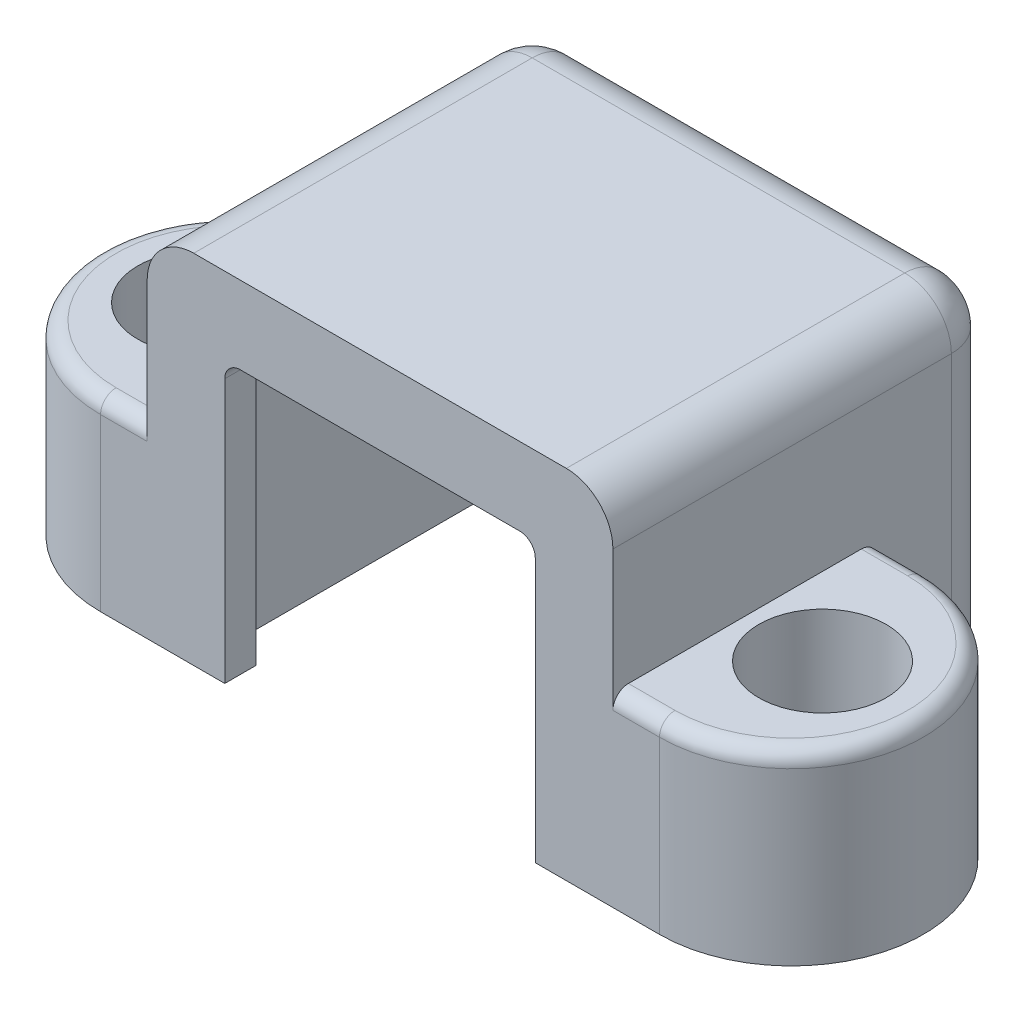
from build123d import *

# Parameters (mm, degrees)
BOSS_EXTRUDE1_DEPTH = 12.4
BOSS_EXTRUDE2_DEPTH = 6
SKETCH4_R           = 2.05
CUT_EXTRUDE1_DEPTH  = 6
FILLET1_R           = 1.5
FILLET2_R           = 0.5
FILLET3_R           = 1
BOSS_EXTRUDE3_DEPTH = 1
FILLET4_R           = 0.5
BOSS_EXTRUDE4_DEPTH = 1
FILLET5_R           = 1.5


with BuildPart() as part:
    # Sketch1 → Boss-Extrude1 (new body)
    with BuildSketch(Plane.XY):
        Polygon((0, 0), (6, 0), (6, -10), (7.5, -10), (7.5, 1.5), (0, 1.5), (-7.5, 1.5), (-7.5, -10), (-6, -10), (-6, 0), align=None)
    extrude(amount=BOSS_EXTRUDE1_DEPTH)

    # Sketch3 → Boss-Extrude2 (add)
    with BuildSketch(Plane.XZ.offset(10)):
        with BuildLine():
            Line((7.5, 3.9), (7.5, 12.4))
            Line((7.5, 12.4), (9, 12.4))
            ThreePointArc((9, 12.4), (13.25, 8.15), (9, 3.9))
            Line((9, 3.9), (7.5, 3.9))
        make_face()
        with BuildLine():
            Line((-7.5, 12.4), (-9, 12.4))
            ThreePointArc((-9, 12.4), (-13.25, 8.15), (-9, 3.9))
            Line((-9, 3.9), (-7.5, 3.9))
            Line((-7.5, 3.9), (-7.5, 12.4))
        make_face()
    extrude(amount=-BOSS_EXTRUDE2_DEPTH)

    # Sketch4 → Cut-Extrude1 (cut)
    with BuildSketch(Plane.XZ.offset(10)):
        with Locations(Location((-10, 8.15, 0), (0, 0, 270))):
            Circle(SKETCH4_R)
        with Locations(Location((10, 8.15, 0), (0, 0, 270))):
            Circle(SKETCH4_R)
    extrude(amount=-CUT_EXTRUDE1_DEPTH, mode=Mode.SUBTRACT)

    # Fillet1
    fillet1_edges = [part.edges().sort_by_distance(p)[0] for p in [
        (-7.5, 1.5, 6.2),
        (7.5, 1.5, 6.2),
    ]]
    fillet(fillet1_edges, radius=FILLET1_R)

    # Fillet2
    fillet2_edges = [part.edges().sort_by_distance(p)[0] for p in [
        (8.25, -4, 3.9),
        (8.25, -4, 12.4),
        (13.25, -4, 8.15),
        (-13.25, -4, 8.15),
        (-8.25, -4, 12.4),
        (-8.25, -4, 3.9),
    ]]
    fillet(fillet2_edges, radius=FILLET2_R)

    # Fillet3
    fillet3_edges = [part.edges().sort_by_distance(p)[0] for p in [
        (6, 0, 6.2),
        (-6, 0, 6.2),
    ]]
    fillet(fillet3_edges, radius=FILLET3_R)

    # Sketch6 → Boss-Extrude3 (add)
    with BuildSketch(Plane(origin=(0, 0, 12.4), x_dir=(-1, 0, 0), z_dir=(0, 0, -1))):
        with BuildLine():
            Line((6, -10), (6, -1))
            ThreePointArc((6, -1), (5.707106781, -0.292893219), (5, 0))
            Line((5, 0), (-5, 0))
            ThreePointArc((-5, 0), (-5.707106781, -0.292893219), (-6, -1))
            Line((-6, -1), (-6, -10))
            Line((-6, -10), (-5, -10))
            Line((-5, -10), (-5, -1))
            Line((-5, -1), (5, -1))
            Line((5, -1), (5, -10))
            Line((5, -10), (6, -10))
        make_face()
    extrude(amount=BOSS_EXTRUDE3_DEPTH)

    # Fillet4
    fillet4_edges = [part.edges().sort_by_distance(p)[0] for p in [
        (5, -1, 11.9),
        (-5, -1, 11.9),
    ]]
    fillet(fillet4_edges, radius=FILLET4_R)

    # Sketch7 → Boss-Extrude4 (add)
    with BuildSketch(Plane(origin=(0, 0, 5.55), x_dir=(-1, 0, 0), z_dir=(0, 0, -1))):
        with BuildLine():
            Line((-4, 0), (-5, 0))
            ThreePointArc((-5, 0), (-5.707106781, -0.292893219), (-6, -1))
            Line((-6, -1), (-6, -2))
            Line((-6, -2), (-4, 0))
        make_face()
        with BuildLine():
            ThreePointArc((5, 0), (5.707106781, -0.292893219), (6, -1))
            Line((6, -1), (6, -2))
            Line((6, -2), (4, 0))
            Line((4, 0), (5, 0))
        make_face()
    extrude(amount=BOSS_EXTRUDE4_DEPTH)

    # Fillet5
    fillet5_edges = [part.edges().sort_by_distance(p)[0] for p in [
        (-7.5, -5, 0),
        (-7.060660172, 1.060660172, 0),
        (0, 1.5, 0),
        (7.060660172, 1.060660172, 0),
        (7.5, -5, 0),
    ]]
    fillet(fillet5_edges, radius=FILLET5_R - 0.0001)  # a hair under: the kernel refuses the full size


solid = part.part
